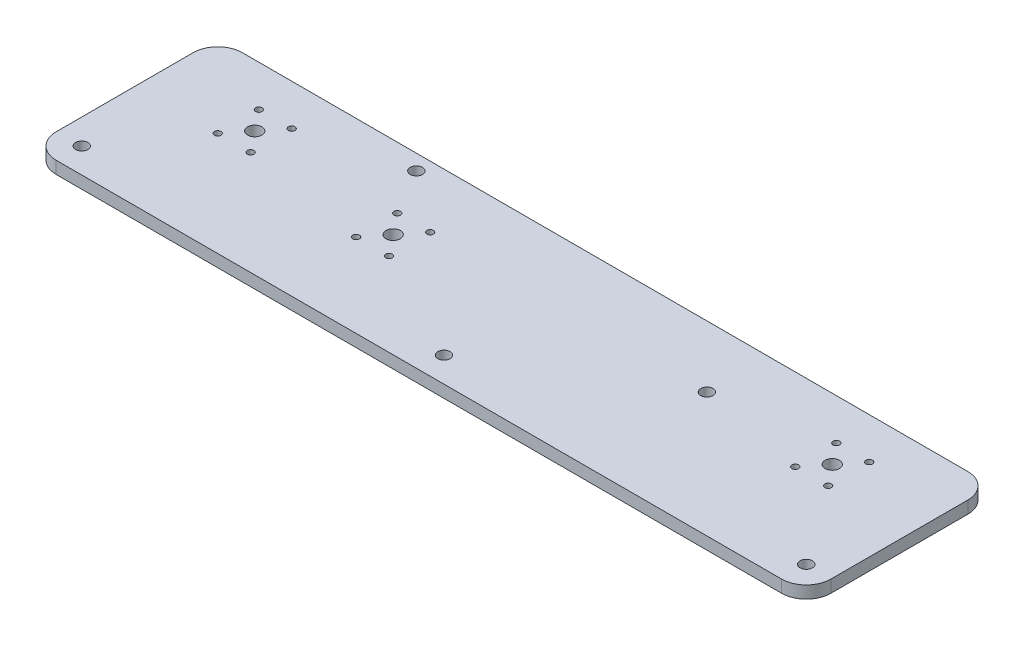
from build123d import *

# Parameters (mm, degrees)
ESBO_O1_R                = 1.6
ESBO_O1_R_2              = 3
ESBO_O1_R_3              = 3.5
RESSALTO_EXTRUS_O1_DEPTH = 6


with BuildPart() as part:
    # Esboço1 → Ressalto-extrusão1 (new body)
    with BuildSketch(Plane(origin=(0, 0, 0), x_dir=(1, 0, 0), z_dir=(0, 1, 0))):
        with BuildLine():
            Line((188.965018959, -38.648697641), (188.965018959, 28))
            ThreePointArc((188.965018959, 28), (185.450300333, 36.485281374), (176.965018959, 40))
            Line((176.965018959, 40), (-176.090826953, 40))
            ThreePointArc((-176.090826953, 40), (-184.576108327, 36.485281374), (-188.090826953, 28))
            Line((-188.090826953, 28), (-188.090826953, -38.648697641))
            ThreePointArc((-188.090826953, -38.648697641), (-184.576108327, -47.133979015), (-176.090826953, -50.648697641))
            Line((-176.090826953, -50.648697641), (176.965018959, -50.648697641))
            ThreePointArc((176.965018959, -50.648697641), (185.450300333, -47.133979015), (188.965018959, -38.648697641))
        make_face()
        with Locations((-54.734509176, -10)):
            Circle(ESBO_O1_R, mode=Mode.SUBTRACT)
        with Locations((176.748138959, -38.431817641)):
            Circle(ESBO_O1_R_2, mode=Mode.SUBTRACT)
        with Locations((0.437096003, -38.431817641)):
            Circle(ESBO_O1_R_2, mode=Mode.SUBTRACT)
        with Locations((79.965018959, 10)):
            Circle(ESBO_O1_R_2, mode=Mode.SUBTRACT)
        with Locations((-140.090826953, 10)):
            Circle(ESBO_O1_R_3, mode=Mode.SUBTRACT)
        with Locations((-148.090826953, 0)):
            Circle(ESBO_O1_R, mode=Mode.SUBTRACT)
        with Locations((-132.090826953, 0)):
            Circle(ESBO_O1_R, mode=Mode.SUBTRACT)
        with Locations((-132.090826953, 20)):
            Circle(ESBO_O1_R, mode=Mode.SUBTRACT)
        with Locations((-148.090826953, 20)):
            Circle(ESBO_O1_R, mode=Mode.SUBTRACT)
        with Locations((-83.930342624, 32.5)):
            Circle(ESBO_O1_R_2, mode=Mode.SUBTRACT)
        with Locations((-175.873946953, -38.431817641)):
            Circle(ESBO_O1_R_2, mode=Mode.SUBTRACT)
        with Locations((-54.734509176, 10)):
            Circle(ESBO_O1_R, mode=Mode.SUBTRACT)
        with Locations((-70.734509176, 10)):
            Circle(ESBO_O1_R, mode=Mode.SUBTRACT)
        with Locations((-70.734509176, -10)):
            Circle(ESBO_O1_R, mode=Mode.SUBTRACT)
        with Locations((-62.734509176, 0)):
            Circle(ESBO_O1_R_3, mode=Mode.SUBTRACT)
        with Locations((132.965018959, 0)):
            Circle(ESBO_O1_R, mode=Mode.SUBTRACT)
        with Locations((148.965018959, 0)):
            Circle(ESBO_O1_R, mode=Mode.SUBTRACT)
        with Locations((148.965018959, 20)):
            Circle(ESBO_O1_R, mode=Mode.SUBTRACT)
        with Locations((132.965018959, 20)):
            Circle(ESBO_O1_R, mode=Mode.SUBTRACT)
        with Locations((140.965018959, 10)):
            Circle(ESBO_O1_R_3, mode=Mode.SUBTRACT)
    extrude(amount=-RESSALTO_EXTRUS_O1_DEPTH)


solid = part.part
